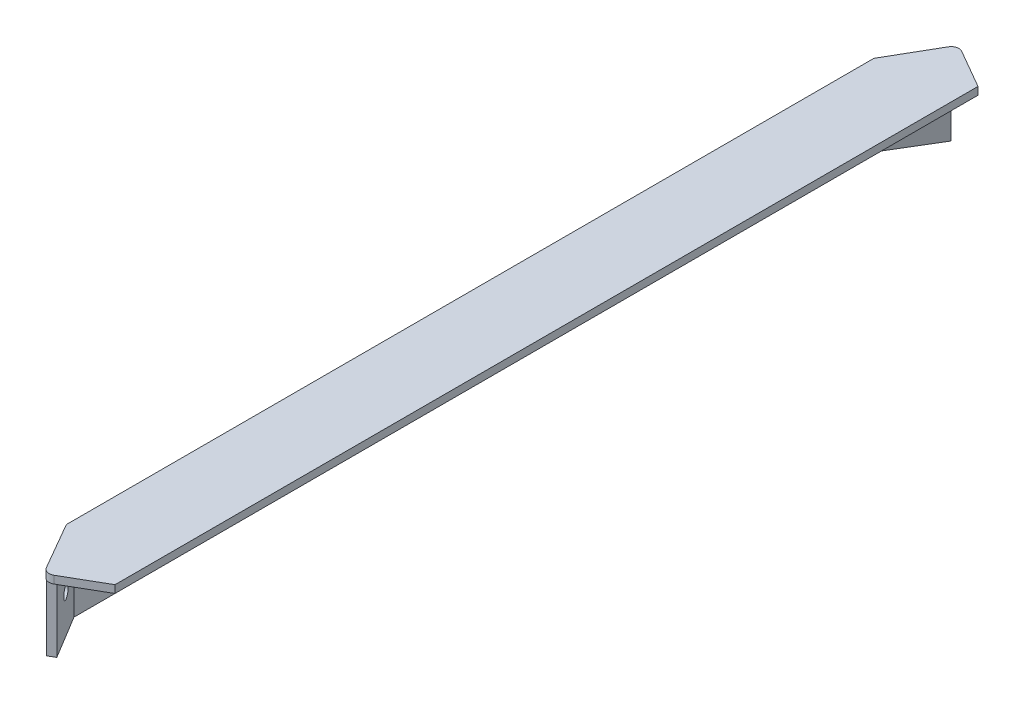
from build123d import *

# Parameters (mm, degrees)
BOSS_EXTRUDE1_DEPTH = 370
BOSS_EXTRUDE2_DEPTH = 63
BOSS_EXTRUDE4_DEPTH = 7
SKETCH10_R          = 6
CUT_EXTRUDE3_DEPTH  = 7
FILLET5_R           = 5


with BuildPart() as part:
    # Sketch1 → Boss-Extrude1 (new body)
    with BuildSketch(Plane.XY):
        Polygon((0, 0), (0, 70), (70, 70), (70, 63), (7, 63), (7, 0), align=None)
    extrude(amount=BOSS_EXTRUDE1_DEPTH)

    # Sketch2 → Boss-Extrude2 (add)
    with BuildSketch(Plane(origin=(0, 0, 0), x_dir=(1, 0, 0), z_dir=(0, 1, 0))):
        Polygon((0, -370), (25, -413.301270189), (31.062177826, -409.801270189), (7, -370), align=None)
    extrude(amount=BOSS_EXTRUDE2_DEPTH)

    # Sketch9 → Boss-Extrude4 (add)
    with BuildSketch(Plane(origin=(0, 63, 0), x_dir=(1, 0, 0), z_dir=(0, 1, 0))):
        with BuildLine():
            Line((0, -370), (25, -413.301270189))
            ThreePointArc((25, -413.301270189), (29.250444511, -416.562750973), (34.562177826, -415.863448016))
            Line((34.562177826, -415.863448016), (70, -395.403411844))
            Line((70, -395.403411844), (70, -370))
            Line((70, -370), (0, -370))
        make_face()
    extrude(amount=BOSS_EXTRUDE4_DEPTH)

    # Sketch10 → Cut-Extrude3 (cut)
    with BuildSketch(Plane(origin=(-158.687655898, 0, 95.935897948), x_dir=(-0.5173609804017633, 0, -0.8557672674026079), z_dir=(0.8557672674026079, 0, -0.5173609804017633))):
        with Locations((-341.764871942, 35)):
            Circle(SKETCH10_R)
    extrude(amount=-CUT_EXTRUDE3_DEPTH, mode=Mode.SUBTRACT)

    # Fillet5
    fillet5_edges = [part.edges().sort_by_distance(p)[0] for p in [
        (19.031088913, 63, 389.900635095),
        (7, 63, 185),
    ]]
    fillet(fillet5_edges, radius=FILLET5_R)

    # Mirror6: part across plane


with BuildPart() as part_1:
    add(part.part)
    add(part.part.mirror(Plane.XY))


solid = part_1.part
